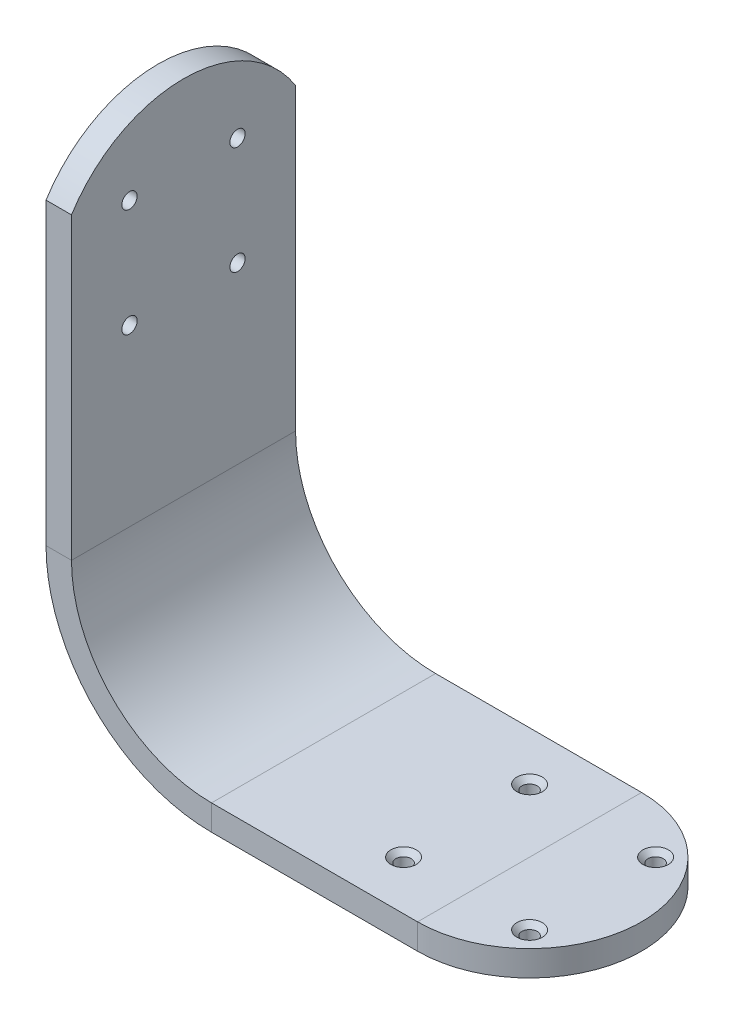
from build123d import *

# Parameters (mm, degrees)
SKETCH_2_W                   = 5
SKETCH_2_H                   = 44
CUT_EXTRUDE_1_DEPTH          = 138.164055573
CUT_EXTRUDE_2_DEPTH          = 115.999267923
HOLE_WIZARD_M31_D            = 3
HOLE_WIZARD_M31_CSINK_D      = 5
HOLE_WIZARD_M31_CSINK_ANGLE  = 90
HOLE_WIZARD_M31_2_AT_2_COUNT = 2
HOLE_WIZARD_M31_2_AT_2_PITCH = 21.213203436
HOLE_WIZARD_M31_2_AT_3_COUNT = 2
HOLE_WIZARD_M31_2_AT_3_PITCH = 21.213203436
HOLE_WIZARD_M31_2_AT_4_COUNT = 2
HOLE_WIZARD_M31_2_AT_4_PITCH = 30


with BuildPart() as part:
    # По траектории1: sweep along a path in Эскиз1
    with BuildLine(Plane.XY) as sweep_1_path:
        Line((0, 42.87893558), (0, -28.521737175))
        ThreePointArc((0, -28.521737175), (8.786796564, -49.734940611), (30, -58.521737175))
        Line((30, -58.521737175), (70.458829053, -58.521737175))
        Line((70.458829053, -58.521737175), (92.458829053, -58.521737175))
    # Эскиз2 → По траектории1 (sweep)
    with BuildSketch(Plane(origin=(0, 0, 0), x_dir=(1, 0, 0), z_dir=(0, 1, 0))):
        Rectangle(SKETCH_2_W, SKETCH_2_H)
    sweep(path=sweep_1_path.line)

    # Эскиз3 → Вырез-Вытянуть1 (cut, through all)
    with BuildSketch(Plane(origin=(0, -56.021737175, 0), x_dir=(1, 0, 0), z_dir=(0, 1, 0))):
        with BuildLine():
            Line((92.458829053, -22), (92.458829053, -3.35e-07))
            ThreePointArc((92.458829053, -3.35e-07), (86.01517812, -15.556349305), (70.458829053, -22))
            Line((70.458829053, -22), (92.458829053, -22))
        make_face()
        with BuildLine():
            Line((92.458829053, 22), (70.458829053, 22))
            ThreePointArc((70.458829053, 22), (86.015178358, 15.556349068), (92.458829053, -3.35e-07))
            Line((92.458829053, -3.35e-07), (92.458829053, 22))
        make_face()
    extrude(amount=-CUT_EXTRUDE_1_DEPTH, mode=Mode.SUBTRACT)

    # Эскиз4 → Вырез-Вытянуть2 (cut, through all)
    with BuildSketch(Plane.ZY.offset(2.5)):
        with BuildLine():
            Line((22, 42.87893558), (-22, 42.87893558))
            Line((-22, 42.87893558), (-22, 30.235342041))
            ThreePointArc((-22, 30.235342041), (0, 42.37893558), (22, 30.235342041))
            Line((22, 30.235342041), (22, 42.87893558))
        make_face()
    extrude(amount=-CUT_EXTRUDE_2_DEPTH, mode=Mode.SUBTRACT)

    # Hole Wizard M31 (through all)
    with Locations(Plane(origin=(0, -56.021737175, 0), x_dir=(1, 0, 0), z_dir=(0, 1, 0))):
        with Locations((58.084460382, -12.374368671), (82.833197724, -12.374368671), (82.833197724, 12.374368671), (58.084460382, 12.374368671)):
            CounterSinkHole(HOLE_WIZARD_M31_D / 2, HOLE_WIZARD_M31_CSINK_D / 2, counter_sink_angle=HOLE_WIZARD_M31_CSINK_ANGLE)

    # Эскиз10 → Hole Wizard M31 2 (revolve, cut)
    with BuildSketch(Plane(origin=(-2.5, 26.985537298, -10.606601718), x_dir=(0, 0, 1), z_dir=(0, 1, 0))):
        Polygon((0, 0), (0, 94.958829053), (1.5, 94.958829053), (1.5, 1.5), (2.75, 1.5), (2.75, 0.525), (3.275, 0), align=None)
    hole_wizard_m31_2 = revolve(axis=Axis((-8.85, 26.985537298, -10.606601718), (1, 0, 0)), mode=Mode.SUBTRACT)

    # Hole Wizard M31 2 at 2: Hole Wizard M31 2 ×2
    with Locations(*[(0, 0, i * HOLE_WIZARD_M31_2_AT_2_PITCH) for i in range(1, HOLE_WIZARD_M31_2_AT_2_COUNT)]):
        add(hole_wizard_m31_2, mode=Mode.SUBTRACT)

    # Hole Wizard M31 2 at 3: Hole Wizard M31 2 ×2
    with Locations(*[(0, -i * HOLE_WIZARD_M31_2_AT_3_PITCH, 0) for i in range(1, HOLE_WIZARD_M31_2_AT_3_COUNT)]):
        add(hole_wizard_m31_2, mode=Mode.SUBTRACT)

    # Hole Wizard M31 2 at 4: Hole Wizard M31 2 ×2
    with Locations(*[Vector(0, -0.7071067811865493, 0.7071067811865457) * (i * HOLE_WIZARD_M31_2_AT_4_PITCH) for i in range(1, HOLE_WIZARD_M31_2_AT_4_COUNT)]):
        add(hole_wizard_m31_2, mode=Mode.SUBTRACT)


solid = part.part
